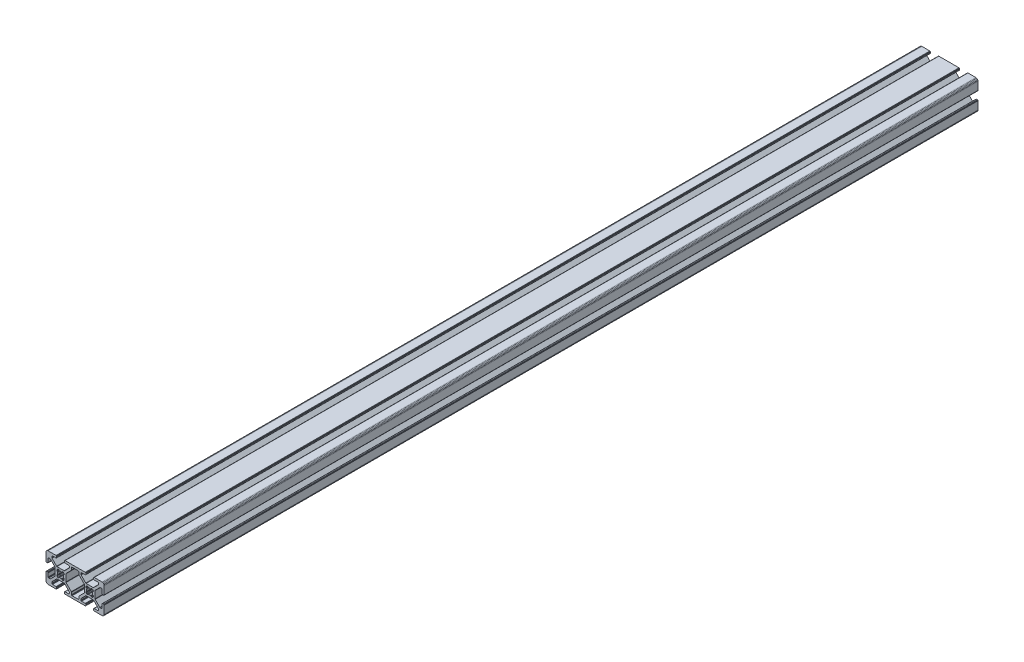
from build123d import *

# Parameters (mm, degrees)
BOSS_EXTRUDE1_DEPTH = 600


with BuildPart() as part:
    # Model → Boss-Extrude1 (new body)
    with BuildSketch(Plane.XY):
        Polygon((955.830371496, 646.201018815), (955.77077468, 646.171628917), (955.715523874, 646.134711509), (955.665564435, 646.090898257), (955.621751183, 646.040938818), (955.584833775, 645.985688012), (955.555443878, 645.926091196), (955.53408436, 645.863168087), (955.52112069, 645.797995318), (955.51677468, 645.731688012), (955.51677468, 645.005768674), (955.517862347, 644.972543884), (955.52112069, 644.939461368), (955.526535758, 644.90666279), (955.53408436, 644.874288599), (955.543734174, 644.842477425), (955.555443878, 644.81136549), (955.569163327, 644.781086019), (955.584833775, 644.751768674), (955.602388117, 644.723538995), (955.621751183, 644.696517868), (955.642840058, 644.670820999), (955.665564435, 644.646558429), (958.768645097, 641.543477767), (958.792907668, 641.52075339), (958.818604536, 641.499664515), (958.845625663, 641.480301449), (958.873855342, 641.462747107), (958.903172687, 641.447076659), (958.933452158, 641.43335721), (958.964564093, 641.421647506), (958.996375267, 641.411997692), (959.028749458, 641.40444909), (959.061548036, 641.399034023), (959.094630552, 641.395775679), (959.127855342, 641.394688012), (963.895694019, 641.394688012), (963.928918808, 641.395775679), (963.962001324, 641.399034023), (963.994799902, 641.40444909), (964.027174093, 641.411997692), (964.058985267, 641.421647506), (964.090097202, 641.43335721), (964.120376673, 641.447076659), (964.149694019, 641.462747107), (964.177923697, 641.480301449), (964.204944825, 641.499664515), (964.230641693, 641.52075339), (964.254904263, 641.543477767), (967.357984925, 644.646558429), (967.380709302, 644.670821), (967.401798177, 644.696517868), (967.421161243, 644.723538995), (967.438715585, 644.751768674), (967.454386033, 644.781086019), (967.468105483, 644.81136549), (967.479815186, 644.842477425), (967.489465, 644.874288599), (967.497013603, 644.90666279), (967.50242867, 644.939461368), (967.505687013, 644.972543884), (967.50677468, 645.005768674), (967.50677468, 645.731688012), (967.50242867, 645.797995318), (967.489465, 645.863168087), (967.468105483, 645.926091196), (967.438715585, 645.985688012), (967.401798177, 646.040938818), (967.357984925, 646.090898257), (967.308025486, 646.134711509), (967.25277468, 646.171628917), (967.193177864, 646.201018815), (967.130254755, 646.222378332), (967.065081986, 646.235342002), (966.99877468, 646.239688012), (964.64977468, 646.239688012), (964.583467374, 646.244034023), (964.518294605, 646.256997692), (964.455371496, 646.27835721), (964.39577468, 646.307747107), (964.340523874, 646.344664515), (964.290564435, 646.388477767), (964.246751183, 646.438437206), (964.209833775, 646.493688012), (964.180443878, 646.553284828), (964.15908436, 646.616207937), (964.146120691, 646.681380706), (964.14177468, 646.747688012), (964.14177468, 647.231688012), (964.146120691, 647.297995318), (964.15908436, 647.363168087), (964.180443878, 647.426091196), (964.209833775, 647.485688012), (964.246751183, 647.540938818), (964.290564435, 647.590898257), (964.340523874, 647.634711509), (964.39577468, 647.671628917), (964.455371496, 647.701018815), (964.518294605, 647.722378332), (964.583467374, 647.735342002), (964.64977468, 647.739688012), (978.37377468, 647.739688012), (978.440081986, 647.735342002), (978.505254755, 647.722378332), (978.568177864, 647.701018815), (978.62777468, 647.671628917), (978.683025486, 647.634711509), (978.732984925, 647.590898257), (978.776798177, 647.540938818), (978.813715585, 647.485688012), (978.843105483, 647.426091196), (978.864465, 647.363168087), (978.87742867, 647.297995318), (978.88177468, 647.231688012), (978.88177468, 646.747688012), (978.87742867, 646.681380706), (978.864465, 646.616207937), (978.843105483, 646.553284828), (978.813715585, 646.493688012), (978.776798177, 646.438437206), (978.732984925, 646.388477767), (978.683025486, 646.344664515), (978.62777468, 646.307747107), (978.568177864, 646.27835721), (978.505254755, 646.256997692), (978.440081986, 646.244034023), (978.37377468, 646.239688012), (976.02477468, 646.239688012), (975.958467374, 646.235342002), (975.893294605, 646.222378332), (975.830371496, 646.201018815), (975.77077468, 646.171628917), (975.715523874, 646.134711509), (975.665564435, 646.090898257), (975.621751183, 646.040938818), (975.584833775, 645.985688012), (975.555443878, 645.926091196), (975.53408436, 645.863168087), (975.521120691, 645.797995318), (975.51677468, 645.731688012), (975.51677468, 645.005768674), (975.517862347, 644.972543884), (975.521120691, 644.939461368), (975.526535758, 644.90666279), (975.53408436, 644.874288599), (975.543734174, 644.842477425), (975.555443878, 644.81136549), (975.569163327, 644.781086019), (975.584833775, 644.751768674), (975.602388117, 644.723538995), (975.621751183, 644.696517868), (975.642840058, 644.670821), (975.665564435, 644.646558429), (978.768645097, 641.543477767), (978.792907668, 641.52075339), (978.818604536, 641.499664515), (978.845625663, 641.480301449), (978.873855342, 641.462747107), (978.903172687, 641.447076659), (978.933452158, 641.43335721), (978.964564093, 641.421647506), (978.996375267, 641.411997692), (979.028749458, 641.40444909), (979.061548036, 641.399034023), (979.094630552, 641.395775679), (979.127855342, 641.394688012), (983.895694019, 641.394688012), (983.928918808, 641.395775679), (983.962001324, 641.399034023), (983.994799902, 641.40444909), (984.027174093, 641.411997692), (984.058985267, 641.421647506), (984.090097202, 641.43335721), (984.120376673, 641.447076659), (984.149694019, 641.462747107), (984.177923697, 641.480301449), (984.204944825, 641.499664515), (984.230641693, 641.52075339), (984.254904263, 641.543477767), (987.357984925, 644.646558429), (987.380709302, 644.670821), (987.401798177, 644.696517868), (987.421161243, 644.723538995), (987.438715585, 644.751768674), (987.454386033, 644.781086019), (987.468105483, 644.81136549), (987.479815186, 644.842477425), (987.489465, 644.874288599), (987.497013603, 644.90666279), (987.50242867, 644.939461368), (987.505687013, 644.972543884), (987.50677468, 645.005768674), (987.50677468, 645.731688012), (987.50242867, 645.797995318), (987.489465, 645.863168087), (987.468105483, 645.926091196), (987.438715585, 645.985688012), (987.401798177, 646.040938818), (987.357984925, 646.090898257), (987.308025486, 646.134711509), (987.25277468, 646.171628917), (987.193177864, 646.201018815), (987.130254755, 646.222378332), (987.065081986, 646.235342002), (986.99877468, 646.239688012), (984.64977468, 646.239688012), (984.583467374, 646.244034023), (984.518294605, 646.256997692), (984.455371496, 646.27835721), (984.39577468, 646.307747107), (984.340523874, 646.344664515), (984.290564435, 646.388477767), (984.246751183, 646.438437206), (984.209833775, 646.493688012), (984.180443878, 646.553284828), (984.15908436, 646.616207937), (984.14612069, 646.681380706), (984.14177468, 646.747688012), (984.14177468, 647.231688012), (984.14612069, 647.297995318), (984.15908436, 647.363168087), (984.180443878, 647.426091196), (984.209833775, 647.485688012), (984.246751183, 647.540938818), (984.290564435, 647.590898257), (984.340523874, 647.634711509), (984.39577468, 647.671628917), (984.455371496, 647.701018815), (984.518294605, 647.722378332), (984.583467374, 647.735342002), (984.64977468, 647.739688012), (990.01177468, 647.739688012), (990.207563968, 647.726855304), (990.400003248, 647.688576752), (990.585799829, 647.625507311), (990.76177468, 647.538726118), (990.924916824, 647.429718023), (991.072434852, 647.300348184), (991.201804691, 647.152830156), (991.310812786, 646.989688012), (991.397593979, 646.813713161), (991.46066342, 646.62791658), (991.498941972, 646.4354773), (991.51177468, 646.239688012), (991.51177468, 640.877688012), (991.50742867, 640.811380706), (991.494465, 640.746207937), (991.473105483, 640.683284828), (991.443715585, 640.623688012), (991.406798177, 640.568437206), (991.362984925, 640.518477767), (991.313025486, 640.474664515), (991.25777468, 640.437747107), (991.198177864, 640.40835721), (991.135254755, 640.386997692), (991.070081986, 640.374034023), (991.00377468, 640.369688012), (990.51977468, 640.369688012), (990.453467374, 640.374034023), (990.388294605, 640.386997692), (990.325371496, 640.40835721), (990.26577468, 640.437747107), (990.210523874, 640.474664515), (990.160564435, 640.518477767), (990.116751183, 640.568437206), (990.079833775, 640.623688012), (990.050443878, 640.683284828), (990.02908436, 640.746207937), (990.01612069, 640.811380706), (990.01177468, 640.877688012), (990.01177468, 643.226688012), (990.00742867, 643.292995318), (989.994465, 643.358168087), (989.973105483, 643.421091196), (989.943715585, 643.480688012), (989.906798177, 643.535938818), (989.862984925, 643.585898257), (989.813025486, 643.629711509), (989.75777468, 643.666628917), (989.698177864, 643.696018815), (989.635254755, 643.717378332), (989.570081986, 643.730342002), (989.50377468, 643.734688012), (988.777855342, 643.734688012), (988.744630552, 643.733600345), (988.711548036, 643.730342002), (988.678749458, 643.724926935), (988.646375267, 643.717378332), (988.614564093, 643.707728518), (988.583452158, 643.696018815), (988.553172687, 643.682299365), (988.523855342, 643.666628917), (988.495625663, 643.649074575), (988.468604536, 643.629711509), (988.442907667, 643.608622634), (988.418645097, 643.585898257), (985.315564435, 640.482817595), (985.292840058, 640.458555025), (985.271751183, 640.432858157), (985.252388117, 640.405837029), (985.234833775, 640.377607351), (985.219163327, 640.348290005), (985.205443878, 640.318010534), (985.193734174, 640.286898599), (985.18408436, 640.255087426), (985.176535758, 640.222713234), (985.17112069, 640.189914656), (985.167862347, 640.15683214), (985.16677468, 640.123607351), (985.16677468, 635.355768674), (985.167862347, 635.322543884), (985.17112069, 635.289461368), (985.176535758, 635.25666279), (985.18408436, 635.224288599), (985.193734174, 635.192477425), (985.205443878, 635.16136549), (985.219163327, 635.131086019), (985.234833775, 635.101768674), (985.252388117, 635.073538995), (985.271751183, 635.046517868), (985.292840058, 635.020821), (985.315564435, 634.996558429), (988.418645097, 631.893477767), (988.442907668, 631.87075339), (988.468604536, 631.849664515), (988.495625663, 631.830301449), (988.523855342, 631.812747107), (988.553172687, 631.797076659), (988.583452158, 631.78335721), (988.614564093, 631.771647506), (988.646375267, 631.761997692), (988.678749458, 631.75444909), (988.711548036, 631.749034023), (988.744630552, 631.745775679), (988.777855342, 631.744688012), (989.50377468, 631.744688012), (989.570081986, 631.749034023), (989.635254755, 631.761997692), (989.698177864, 631.78335721), (989.75777468, 631.812747107), (989.813025486, 631.849664515), (989.862984925, 631.893477767), (989.906798177, 631.943437206), (989.943715585, 631.998688012), (989.973105483, 632.058284828), (989.994465, 632.121207937), (990.00742867, 632.186380706), (990.01177468, 632.252688012), (990.01177468, 634.601688012), (990.016120691, 634.667995318), (990.02908436, 634.733168087), (990.050443878, 634.796091196), (990.079833775, 634.855688012), (990.116751183, 634.910938818), (990.160564435, 634.960898257), (990.210523874, 635.004711509), (990.26577468, 635.041628917), (990.325371496, 635.071018815), (990.388294605, 635.092378332), (990.453467374, 635.105342002), (990.51977468, 635.109688012), (991.00377468, 635.109688012), (991.070081986, 635.105342002), (991.135254755, 635.092378332), (991.198177864, 635.071018815), (991.25777468, 635.041628917), (991.313025486, 635.004711509), (991.362984925, 634.960898257), (991.406798177, 634.910938818), (991.443715585, 634.855688012), (991.473105483, 634.796091196), (991.494465, 634.733168087), (991.50742867, 634.667995318), (991.51177468, 634.601688012), (991.51177468, 629.239688012), (991.498941972, 629.043898724), (991.46066342, 628.851459444), (991.397593979, 628.665662864), (991.310812786, 628.489688012), (991.201804691, 628.326545869), (991.072434852, 628.17902784), (990.924916824, 628.049658002), (990.76177468, 627.940649906), (990.585799829, 627.853868713), (990.400003248, 627.790799273), (990.207563968, 627.75252072), (990.01177468, 627.739688012), (984.64977468, 627.739688012), (984.583467374, 627.744034023), (984.518294605, 627.756997692), (984.455371496, 627.77835721), (984.39577468, 627.807747107), (984.340523874, 627.844664515), (984.290564435, 627.888477767), (984.246751183, 627.938437206), (984.209833775, 627.993688012), (984.180443878, 628.053284828), (984.15908436, 628.116207937), (984.146120691, 628.181380706), (984.14177468, 628.247688012), (984.14177468, 628.731688012), (984.146120691, 628.797995318), (984.15908436, 628.863168087), (984.180443878, 628.926091196), (984.209833775, 628.985688012), (984.246751183, 629.040938818), (984.290564435, 629.090898257), (984.340523874, 629.134711509), (984.39577468, 629.171628917), (984.455371496, 629.201018815), (984.518294605, 629.222378332), (984.583467374, 629.235342002), (984.64977468, 629.239688012), (986.99877468, 629.239688012), (987.065081986, 629.244034023), (987.130254755, 629.256997692), (987.193177864, 629.27835721), (987.25277468, 629.307747107), (987.308025486, 629.344664515), (987.357984925, 629.388477767), (987.401798177, 629.438437206), (987.438715585, 629.493688012), (987.468105483, 629.553284828), (987.489465, 629.616207937), (987.50242867, 629.681380706), (987.50677468, 629.747688012), (987.50677468, 630.473607351), (987.505687013, 630.50683214), (987.50242867, 630.539914656), (987.497013603, 630.572713234), (987.489465, 630.605087426), (987.479815186, 630.636898599), (987.468105483, 630.668010534), (987.454386033, 630.698290005), (987.438715585, 630.727607351), (987.421161243, 630.755837029), (987.401798177, 630.782858157), (987.380709302, 630.808555025), (987.357984925, 630.832817595), (984.254904263, 633.935898257), (984.230641693, 633.958622634), (984.204944825, 633.979711509), (984.177923697, 633.999074575), (984.149694019, 634.016628917), (984.120376673, 634.032299365), (984.090097202, 634.046018815), (984.058985267, 634.057728518), (984.027174093, 634.067378332), (983.994799902, 634.074926935), (983.962001324, 634.080342002), (983.928918808, 634.083600345), (983.895694019, 634.084688012), (979.127855342, 634.084688012), (979.094630552, 634.083600345), (979.061548036, 634.080342002), (979.028749458, 634.074926935), (978.996375267, 634.067378332), (978.964564093, 634.057728518), (978.933452158, 634.046018815), (978.903172687, 634.032299365), (978.873855342, 634.016628917), (978.845625663, 633.999074575), (978.818604536, 633.979711509), (978.792907668, 633.958622634), (978.768645097, 633.935898257), (975.665564435, 630.832817595), (975.642840058, 630.808555025), (975.621751183, 630.782858157), (975.602388117, 630.755837029), (975.584833775, 630.727607351), (975.569163327, 630.698290005), (975.555443878, 630.668010534), (975.543734174, 630.636898599), (975.53408436, 630.605087425), (975.526535758, 630.572713234), (975.521120691, 630.539914656), (975.517862347, 630.50683214), (975.51677468, 630.473607351), (975.51677468, 629.747688012), (975.521120691, 629.681380706), (975.53408436, 629.616207937), (975.555443878, 629.553284828), (975.584833775, 629.493688012), (975.621751183, 629.438437206), (975.665564435, 629.388477767), (975.715523874, 629.344664515), (975.77077468, 629.307747107), (975.830371496, 629.27835721), (975.893294605, 629.256997692), (975.958467374, 629.244034023), (976.02477468, 629.239688012), (978.37377468, 629.239688012), (978.440081986, 629.235342002), (978.505254755, 629.222378332), (978.568177864, 629.201018815), (978.62777468, 629.171628917), (978.683025486, 629.134711509), (978.732984925, 629.090898257), (978.776798177, 629.040938818), (978.813715585, 628.985688012), (978.843105483, 628.926091196), (978.864465, 628.863168087), (978.87742867, 628.797995318), (978.88177468, 628.731688012), (978.88177468, 628.247688012), (978.87742867, 628.181380706), (978.864465, 628.116207937), (978.843105483, 628.053284828), (978.813715585, 627.993688012), (978.776798177, 627.938437206), (978.732984925, 627.888477767), (978.683025486, 627.844664515), (978.62777468, 627.807747107), (978.568177864, 627.77835721), (978.505254755, 627.756997692), (978.440081986, 627.744034023), (978.37377468, 627.739688012), (964.64977468, 627.739688012), (964.583467374, 627.744034023), (964.518294605, 627.756997692), (964.455371496, 627.77835721), (964.39577468, 627.807747107), (964.340523874, 627.844664515), (964.290564435, 627.888477767), (964.246751183, 627.938437206), (964.209833775, 627.993688012), (964.180443878, 628.053284828), (964.15908436, 628.116207937), (964.146120691, 628.181380706), (964.14177468, 628.247688012), (964.14177468, 628.731688012), (964.146120691, 628.797995318), (964.15908436, 628.863168087), (964.180443878, 628.926091196), (964.209833775, 628.985688012), (964.246751183, 629.040938818), (964.290564435, 629.090898257), (964.340523874, 629.134711509), (964.39577468, 629.171628917), (964.455371496, 629.201018815), (964.518294605, 629.222378332), (964.583467374, 629.235342002), (964.64977468, 629.239688012), (966.99877468, 629.239688012), (967.065081986, 629.244034023), (967.130254755, 629.256997692), (967.193177864, 629.27835721), (967.25277468, 629.307747107), (967.308025486, 629.344664515), (967.357984925, 629.388477767), (967.401798177, 629.438437206), (967.438715585, 629.493688012), (967.468105483, 629.553284828), (967.489465, 629.616207937), (967.50242867, 629.681380706), (967.50677468, 629.747688012), (967.50677468, 630.473607351), (967.505687013, 630.50683214), (967.50242867, 630.539914656), (967.497013603, 630.572713234), (967.489465, 630.605087425), (967.479815186, 630.636898599), (967.468105483, 630.668010534), (967.454386033, 630.698290005), (967.438715585, 630.727607351), (967.421161243, 630.755837029), (967.401798177, 630.782858157), (967.380709302, 630.808555025), (967.357984925, 630.832817595), (964.254904263, 633.935898257), (964.230641693, 633.958622634), (964.204944825, 633.979711509), (964.177923697, 633.999074575), (964.149694019, 634.016628917), (964.120376673, 634.032299365), (964.090097202, 634.046018815), (964.058985267, 634.057728518), (964.027174093, 634.067378332), (963.994799902, 634.074926935), (963.962001324, 634.080342002), (963.928918808, 634.083600345), (963.895694019, 634.084688012), (959.127855342, 634.084688012), (959.094630552, 634.083600345), (959.061548036, 634.080342002), (959.028749458, 634.074926935), (958.996375267, 634.067378332), (958.964564093, 634.057728518), (958.933452158, 634.046018815), (958.903172687, 634.032299365), (958.873855342, 634.016628917), (958.845625663, 633.999074575), (958.818604536, 633.979711509), (958.792907668, 633.958622634), (958.768645097, 633.935898257), (955.665564435, 630.832817595), (955.642840058, 630.808555025), (955.621751183, 630.782858157), (955.602388117, 630.755837029), (955.584833775, 630.727607351), (955.569163327, 630.698290005), (955.555443878, 630.668010534), (955.543734174, 630.636898599), (955.53408436, 630.605087425), (955.526535758, 630.572713234), (955.521120691, 630.539914656), (955.517862347, 630.50683214), (955.51677468, 630.473607351), (955.51677468, 629.747688012), (955.521120691, 629.681380706), (955.53408436, 629.616207937), (955.555443878, 629.553284828), (955.584833775, 629.493688012), (955.621751183, 629.438437206), (955.665564435, 629.388477767), (955.715523874, 629.344664515), (955.77077468, 629.307747107), (955.830371496, 629.27835721), (955.893294605, 629.256997692), (955.958467374, 629.244034023), (956.02477468, 629.239688012), (958.37377468, 629.239688012), (958.440081986, 629.235342002), (958.505254755, 629.222378332), (958.568177864, 629.201018815), (958.62777468, 629.171628917), (958.683025486, 629.134711509), (958.732984925, 629.090898257), (958.776798177, 629.040938818), (958.813715585, 628.985688012), (958.843105483, 628.926091196), (958.864465, 628.863168087), (958.87742867, 628.797995318), (958.88177468, 628.731688012), (958.88177468, 628.247688012), (958.87742867, 628.181380706), (958.864465, 628.116207937), (958.843105483, 628.053284828), (958.813715585, 627.993688012), (958.776798177, 627.938437206), (958.732984925, 627.888477767), (958.683025486, 627.844664515), (958.62777468, 627.807747107), (958.568177864, 627.77835721), (958.505254755, 627.756997692), (958.440081986, 627.744034023), (958.37377468, 627.739688012), (953.01177468, 627.739688012), (952.815985392, 627.75252072), (952.623546112, 627.790799273), (952.437749532, 627.853868713), (952.26177468, 627.940649906), (952.098632537, 628.049658002), (951.951114508, 628.17902784), (951.82174467, 628.326545869), (951.712736574, 628.489688012), (951.625955381, 628.665662864), (951.562885941, 628.851459444), (951.524607388, 629.043898724), (951.51177468, 629.239688012), (951.51177468, 634.601688012), (951.516120691, 634.667995318), (951.52908436, 634.733168087), (951.550443878, 634.796091196), (951.579833775, 634.855688012), (951.616751183, 634.910938818), (951.660564435, 634.960898257), (951.710523874, 635.004711509), (951.76577468, 635.041628917), (951.825371496, 635.071018815), (951.888294605, 635.092378332), (951.953467374, 635.105342002), (952.01977468, 635.109688012), (952.50377468, 635.109688012), (952.570081986, 635.105342002), (952.635254755, 635.092378332), (952.698177864, 635.071018815), (952.75777468, 635.041628917), (952.813025486, 635.004711509), (952.862984925, 634.960898257), (952.906798177, 634.910938818), (952.943715585, 634.855688012), (952.973105483, 634.796091196), (952.994465, 634.733168087), (953.00742867, 634.667995318), (953.01177468, 634.601688012), (953.01177468, 632.252688012), (953.016120691, 632.186380706), (953.02908436, 632.121207937), (953.050443878, 632.058284828), (953.079833775, 631.998688012), (953.116751183, 631.943437206), (953.160564435, 631.893477767), (953.210523874, 631.849664515), (953.26577468, 631.812747107), (953.325371496, 631.78335721), (953.388294605, 631.761997692), (953.453467374, 631.749034023), (953.51977468, 631.744688012), (954.245694019, 631.744688012), (954.278918808, 631.745775679), (954.312001324, 631.749034023), (954.344799902, 631.75444909), (954.377174093, 631.761997692), (954.408985267, 631.771647506), (954.440097202, 631.78335721), (954.470376673, 631.797076659), (954.499694019, 631.812747107), (954.527923697, 631.830301449), (954.554944825, 631.849664515), (954.580641693, 631.87075339), (954.604904263, 631.893477767), (957.707984925, 634.996558429), (957.730709302, 635.020821), (957.751798177, 635.046517868), (957.771161243, 635.073538995), (957.788715585, 635.101768674), (957.804386033, 635.131086019), (957.818105483, 635.16136549), (957.829815186, 635.192477425), (957.839465, 635.224288599), (957.847013603, 635.25666279), (957.85242867, 635.289461368), (957.855687013, 635.322543884), (957.85677468, 635.355768674), (957.85677468, 640.123607351), (957.855687013, 640.15683214), (957.85242867, 640.189914656), (957.847013603, 640.222713234), (957.839465, 640.255087425), (957.829815186, 640.286898599), (957.818105483, 640.318010534), (957.804386033, 640.348290005), (957.788715585, 640.377607351), (957.771161243, 640.405837029), (957.751798177, 640.432858157), (957.730709302, 640.458555025), (957.707984925, 640.482817595), (954.604904263, 643.585898257), (954.580641693, 643.608622634), (954.554944825, 643.629711509), (954.527923697, 643.649074575), (954.499694019, 643.666628917), (954.470376673, 643.682299365), (954.440097202, 643.696018815), (954.408985267, 643.707728518), (954.377174093, 643.717378332), (954.344799902, 643.724926935), (954.312001324, 643.730342002), (954.278918808, 643.733600345), (954.245694019, 643.734688012), (953.51977468, 643.734688012), (953.453467374, 643.730342002), (953.388294605, 643.717378332), (953.325371496, 643.696018815), (953.26577468, 643.666628917), (953.210523874, 643.629711509), (953.160564435, 643.585898257), (953.116751183, 643.535938818), (953.079833775, 643.480688012), (953.050443878, 643.421091196), (953.02908436, 643.358168087), (953.01612069, 643.292995318), (953.01177468, 643.226688012), (953.01177468, 640.877688012), (953.00742867, 640.811380706), (952.994465, 640.746207937), (952.973105483, 640.683284828), (952.943715585, 640.623688012), (952.906798177, 640.568437206), (952.862984925, 640.518477767), (952.813025486, 640.474664515), (952.75777468, 640.437747107), (952.698177864, 640.40835721), (952.635254755, 640.386997692), (952.570081986, 640.374034022), (952.50377468, 640.369688012), (952.01977468, 640.369688012), (951.953467374, 640.374034022), (951.888294605, 640.386997692), (951.825371496, 640.40835721), (951.76577468, 640.437747107), (951.710523874, 640.474664515), (951.660564435, 640.518477767), (951.616751183, 640.568437206), (951.579833775, 640.623688012), (951.550443878, 640.683284828), (951.52908436, 640.746207937), (951.51612069, 640.811380706), (951.51177468, 640.877688012), (951.51177468, 646.239688012), (951.524607388, 646.4354773), (951.562885941, 646.62791658), (951.625955381, 646.813713161), (951.712736574, 646.989688012), (951.82174467, 647.152830156), (951.951114508, 647.300348184), (952.098632537, 647.429718023), (952.26177468, 647.538726118), (952.437749532, 647.625507311), (952.623546112, 647.688576751), (952.815985392, 647.726855304), (953.01177468, 647.739688012), (958.37377468, 647.739688012), (958.440081986, 647.735342002), (958.505254755, 647.722378332), (958.568177864, 647.701018815), (958.62777468, 647.671628917), (958.683025486, 647.634711509), (958.732984925, 647.590898257), (958.776798177, 647.540938818), (958.813715585, 647.485688012), (958.843105483, 647.426091196), (958.864465, 647.363168087), (958.87742867, 647.297995318), (958.88177468, 647.231688012), (958.88177468, 646.747688012), (958.87742867, 646.681380706), (958.864465, 646.616207937), (958.843105483, 646.553284828), (958.813715585, 646.493688012), (958.776798177, 646.438437206), (958.732984925, 646.388477767), (958.683025486, 646.344664515), (958.62777468, 646.307747107), (958.568177864, 646.27835721), (958.505254755, 646.256997692), (958.440081986, 646.244034022), (958.37377468, 646.239688012), (956.02477468, 646.239688012), (955.958467374, 646.235342002), (955.893294605, 646.222378332), align=None)
        Polygon((961.101867381, 635.684670675), (961.237518732, 635.662212639), (961.374350872, 635.648699024), (961.51177468, 635.644188012), (961.649198488, 635.648699024), (961.786030628, 635.662212639), (961.921681979, 635.684670675), (962.055568504, 635.71597644), (962.187113763, 635.755995149), (962.315751398, 635.804554506), (962.360433376, 635.673351007), (962.427439659, 635.552020899), (962.514691929, 635.444327452), (962.6194839, 635.35361097), (962.738565261, 635.282685188), (962.868242491, 635.233749995), (963.004493419, 635.208323205), (963.143091979, 635.207193473), (963.279739289, 635.230395842), (963.410196988, 635.277210647), (963.530418696, 635.346185845), (963.636675524, 635.435182046), (963.816280646, 635.614787168), (963.905276847, 635.721043996), (963.974252045, 635.841265705), (964.02106685, 635.971723403), (964.044269219, 636.108370713), (964.043139488, 636.246969273), (964.017712697, 636.383220201), (963.968777504, 636.512897432), (963.897851722, 636.631978793), (963.80713524, 636.736770763), (963.699441793, 636.824023033), (963.578111685, 636.891029316), (963.446908186, 636.935711294), (963.495467543, 637.064348929), (963.535486252, 637.195894189), (963.566792017, 637.329780713), (963.589250053, 637.465432064), (963.602763668, 637.602264204), (963.60727468, 637.739688012), (963.602763668, 637.87711182), (963.589250053, 638.01394396), (963.566792017, 638.149595311), (963.535486252, 638.283481836), (963.495467543, 638.415027095), (963.446908186, 638.54366473), (963.578111685, 638.588346708), (963.699441793, 638.655352991), (963.80713524, 638.742605261), (963.897851722, 638.847397232), (963.968777504, 638.966478593), (964.017712697, 639.096155823), (964.043139488, 639.232406751), (964.044269219, 639.371005311), (964.02106685, 639.507652621), (963.974252045, 639.63811032), (963.905276847, 639.758332028), (963.816280646, 639.864588856), (963.636675524, 640.044193978), (963.530418696, 640.133190179), (963.410196988, 640.202165377), (963.279739289, 640.248980182), (963.143091979, 640.272182551), (963.004493419, 640.27105282), (962.868242491, 640.245626029), (962.738565261, 640.196690836), (962.6194839, 640.125765054), (962.514691929, 640.035048572), (962.427439659, 639.927355125), (962.360433376, 639.806025017), (962.315751398, 639.674821518), (962.187113763, 639.723380875), (962.055568504, 639.763399584), (961.921681979, 639.794705349), (961.786030628, 639.817163385), (961.649198488, 639.830677), (961.51177468, 639.835188012), (961.374350872, 639.830677), (961.237518732, 639.817163385), (961.101867381, 639.794705349), (960.967980857, 639.763399584), (960.836435597, 639.723380875), (960.707797962, 639.674821518), (960.663115984, 639.806025017), (960.596109701, 639.927355125), (960.508857431, 640.035048572), (960.404065461, 640.125765054), (960.2849841, 640.196690836), (960.155306869, 640.245626029), (960.019055941, 640.27105282), (959.880457381, 640.272182551), (959.743810071, 640.248980182), (959.613352373, 640.202165377), (959.493130664, 640.133190179), (959.386873836, 640.044193978), (959.207268714, 639.864588856), (959.118272513, 639.758332028), (959.049297315, 639.63811032), (959.00248251, 639.507652621), (958.979280141, 639.371005311), (958.980409873, 639.232406751), (959.005836663, 639.096155823), (959.054771856, 638.966478593), (959.125697638, 638.847397232), (959.21641412, 638.742605261), (959.324107567, 638.655352991), (959.445437675, 638.588346708), (959.576641174, 638.54366473), (959.528081817, 638.415027095), (959.488063108, 638.283481836), (959.456757343, 638.149595311), (959.434299307, 638.01394396), (959.420785692, 637.87711182), (959.41627468, 637.739688012), (959.420785692, 637.602264204), (959.434299307, 637.465432064), (959.456757343, 637.329780713), (959.488063108, 637.195894189), (959.528081817, 637.064348929), (959.576641174, 636.935711294), (959.445437675, 636.891029316), (959.324107567, 636.824023033), (959.21641412, 636.736770763), (959.125697638, 636.631978793), (959.054771856, 636.512897432), (959.005836663, 636.383220201), (958.980409873, 636.246969273), (958.979280141, 636.108370713), (959.00248251, 635.971723403), (959.049297315, 635.841265705), (959.118272513, 635.721043996), (959.207268714, 635.614787168), (959.386873836, 635.435182046), (959.493130664, 635.346185845), (959.613352373, 635.277210647), (959.743810071, 635.230395842), (959.880457381, 635.207193473), (960.019055941, 635.208323205), (960.155306869, 635.233749995), (960.2849841, 635.282685188), (960.404065461, 635.35361097), (960.508857431, 635.444327452), (960.596109701, 635.552020899), (960.663115984, 635.673351007), (960.707797962, 635.804554506), (960.836435597, 635.755995149), (960.967980857, 635.71597644), align=None, mode=Mode.SUBTRACT)
        Polygon((973.818025486, 646.134711509), (973.76277468, 646.171628917), (973.703177864, 646.201018815), (973.640254755, 646.222378332), (973.575081986, 646.235342002), (973.50877468, 646.239688012), (969.51477468, 646.239688012), (969.448467374, 646.235342002), (969.383294605, 646.222378332), (969.320371496, 646.201018815), (969.26077468, 646.171628917), (969.205523874, 646.134711509), (969.155564435, 646.090898257), (969.111751183, 646.040938818), (969.074833775, 645.985688012), (969.045443878, 645.926091196), (969.02408436, 645.863168087), (969.011120691, 645.797995318), (969.00677468, 645.731688012), (969.00677468, 644.38444833), (969.005687013, 644.35122354), (969.00242867, 644.318141024), (968.997013603, 644.285342446), (968.989465, 644.252968255), (968.979815186, 644.221157082), (968.968105483, 644.190045146), (968.954386033, 644.159765675), (968.938715585, 644.13044833), (968.921161243, 644.102218652), (968.901798177, 644.075197524), (968.880709302, 644.049500656), (968.857984925, 644.025238085), (965.315564435, 640.482817595), (965.292840058, 640.458555025), (965.271751183, 640.432858157), (965.252388117, 640.405837029), (965.234833775, 640.377607351), (965.219163327, 640.348290005), (965.205443878, 640.318010534), (965.193734174, 640.286898599), (965.18408436, 640.255087425), (965.176535758, 640.222713234), (965.171120691, 640.189914656), (965.167862347, 640.15683214), (965.16677468, 640.123607351), (965.16677468, 635.355768674), (965.167862347, 635.322543884), (965.171120691, 635.289461368), (965.176535758, 635.25666279), (965.18408436, 635.224288599), (965.193734174, 635.192477425), (965.205443878, 635.16136549), (965.219163327, 635.131086019), (965.234833775, 635.101768674), (965.252388117, 635.073538995), (965.271751183, 635.046517868), (965.292840058, 635.020821), (965.315564435, 634.996558429), (968.857984925, 631.454137939), (968.880709302, 631.429875368), (968.901798177, 631.4041785), (968.921161243, 631.377157373), (968.938715585, 631.348927694), (968.954386033, 631.319610349), (968.968105483, 631.289330878), (968.979815186, 631.258218943), (968.989465, 631.226407769), (968.997013603, 631.194033578), (969.00242867, 631.161235), (969.005687013, 631.128152484), (969.00677468, 631.094927694), (969.00677468, 629.747688012), (969.011120691, 629.681380706), (969.02408436, 629.616207937), (969.045443878, 629.553284828), (969.074833775, 629.493688012), (969.111751183, 629.438437206), (969.155564435, 629.388477767), (969.205523874, 629.344664515), (969.26077468, 629.307747107), (969.320371497, 629.27835721), (969.383294605, 629.256997692), (969.448467374, 629.244034023), (969.51477468, 629.239688012), (973.50877468, 629.239688012), (973.575081986, 629.244034023), (973.640254755, 629.256997692), (973.703177864, 629.27835721), (973.76277468, 629.307747107), (973.818025486, 629.344664515), (973.867984925, 629.388477767), (973.911798177, 629.438437206), (973.948715585, 629.493688012), (973.978105483, 629.553284828), (973.999465, 629.616207937), (974.01242867, 629.681380706), (974.01677468, 629.747688012), (974.01677468, 631.094927694), (974.017862347, 631.128152484), (974.021120691, 631.161235), (974.026535758, 631.194033578), (974.03408436, 631.226407769), (974.043734174, 631.258218943), (974.055443878, 631.289330878), (974.069163327, 631.319610349), (974.084833775, 631.348927694), (974.102388117, 631.377157373), (974.121751183, 631.4041785), (974.142840058, 631.429875368), (974.165564435, 631.454137939), (977.707984925, 634.996558429), (977.730709302, 635.020821), (977.751798177, 635.046517868), (977.771161243, 635.073538995), (977.788715585, 635.101768674), (977.804386033, 635.131086019), (977.818105483, 635.16136549), (977.829815186, 635.192477425), (977.839465, 635.224288599), (977.847013603, 635.25666279), (977.85242867, 635.289461368), (977.855687013, 635.322543884), (977.85677468, 635.355768674), (977.85677468, 640.123607351), (977.855687013, 640.15683214), (977.85242867, 640.189914656), (977.847013603, 640.222713234), (977.839465, 640.255087426), (977.829815186, 640.286898599), (977.818105483, 640.318010534), (977.804386033, 640.348290005), (977.788715585, 640.377607351), (977.771161243, 640.405837029), (977.751798177, 640.432858157), (977.730709302, 640.458555025), (977.707984925, 640.482817595), (974.165564435, 644.025238085), (974.142840058, 644.049500656), (974.121751183, 644.075197524), (974.102388117, 644.102218652), (974.084833775, 644.13044833), (974.069163327, 644.159765675), (974.055443878, 644.190045146), (974.043734174, 644.221157082), (974.03408436, 644.252968255), (974.026535758, 644.285342446), (974.021120691, 644.318141024), (974.017862347, 644.35122354), (974.01677468, 644.38444833), (974.01677468, 645.731688012), (974.01242867, 645.797995318), (973.999465, 645.863168087), (973.978105483, 645.926091196), (973.948715585, 645.985688012), (973.911798177, 646.040938818), (973.867984925, 646.090898257), align=None, mode=Mode.SUBTRACT)
        Polygon((979.456757343, 638.149595311), (979.434299307, 638.01394396), (979.420785692, 637.87711182), (979.41627468, 637.739688012), (979.420785692, 637.602264204), (979.434299307, 637.465432064), (979.456757343, 637.329780713), (979.488063108, 637.195894189), (979.528081817, 637.064348929), (979.576641174, 636.935711294), (979.445437675, 636.891029316), (979.324107567, 636.824023033), (979.21641412, 636.736770763), (979.125697638, 636.631978793), (979.054771856, 636.512897432), (979.005836663, 636.383220201), (978.980409873, 636.246969273), (978.979280141, 636.108370713), (979.00248251, 635.971723403), (979.049297315, 635.841265705), (979.118272513, 635.721043996), (979.207268714, 635.614787168), (979.386873836, 635.435182046), (979.493130664, 635.346185845), (979.613352373, 635.277210647), (979.743810071, 635.230395842), (979.880457381, 635.207193473), (980.019055941, 635.208323205), (980.155306869, 635.233749995), (980.2849841, 635.282685188), (980.404065461, 635.35361097), (980.508857431, 635.444327452), (980.596109701, 635.552020899), (980.663115984, 635.673351007), (980.707797962, 635.804554506), (980.836435597, 635.755995149), (980.967980857, 635.71597644), (981.101867381, 635.684670675), (981.237518732, 635.662212639), (981.374350872, 635.648699024), (981.51177468, 635.644188012), (981.649198488, 635.648699024), (981.786030628, 635.662212639), (981.921681979, 635.684670675), (982.055568504, 635.71597644), (982.187113763, 635.755995149), (982.315751398, 635.804554506), (982.360433376, 635.673351007), (982.427439659, 635.552020899), (982.514691929, 635.444327452), (982.6194839, 635.35361097), (982.738565261, 635.282685188), (982.868242491, 635.233749995), (983.004493419, 635.208323205), (983.143091979, 635.207193473), (983.279739289, 635.230395842), (983.410196988, 635.277210647), (983.530418696, 635.346185845), (983.636675524, 635.435182046), (983.816280646, 635.614787168), (983.905276847, 635.721043996), (983.974252045, 635.841265705), (984.02106685, 635.971723403), (984.044269219, 636.108370713), (984.043139488, 636.246969273), (984.017712697, 636.383220201), (983.968777504, 636.512897432), (983.897851722, 636.631978793), (983.80713524, 636.736770763), (983.699441793, 636.824023033), (983.578111685, 636.891029316), (983.446908186, 636.935711294), (983.495467543, 637.064348929), (983.535486252, 637.195894189), (983.566792017, 637.329780713), (983.589250053, 637.465432064), (983.602763668, 637.602264204), (983.60727468, 637.739688012), (983.602763668, 637.87711182), (983.589250053, 638.01394396), (983.566792017, 638.149595311), (983.535486252, 638.283481836), (983.495467543, 638.415027095), (983.446908186, 638.54366473), (983.578111685, 638.588346708), (983.699441793, 638.655352991), (983.80713524, 638.742605261), (983.897851722, 638.847397232), (983.968777504, 638.966478593), (984.017712697, 639.096155823), (984.043139488, 639.232406751), (984.044269219, 639.371005311), (984.02106685, 639.507652621), (983.974252045, 639.63811032), (983.905276847, 639.758332028), (983.816280646, 639.864588856), (983.636675524, 640.044193978), (983.530418696, 640.133190179), (983.410196988, 640.202165377), (983.279739289, 640.248980182), (983.143091979, 640.272182551), (983.004493419, 640.27105282), (982.868242491, 640.245626029), (982.738565261, 640.196690836), (982.6194839, 640.125765054), (982.514691929, 640.035048572), (982.427439659, 639.927355125), (982.360433376, 639.806025017), (982.315751398, 639.674821518), (982.187113763, 639.723380875), (982.055568504, 639.763399584), (981.921681979, 639.794705349), (981.786030628, 639.817163385), (981.649198488, 639.830677), (981.51177468, 639.835188012), (981.374350872, 639.830677), (981.237518732, 639.817163385), (981.101867381, 639.794705349), (980.967980857, 639.763399584), (980.836435597, 639.723380875), (980.707797962, 639.674821518), (980.663115984, 639.806025017), (980.596109701, 639.927355125), (980.508857431, 640.035048572), (980.404065461, 640.125765054), (980.2849841, 640.196690836), (980.155306869, 640.245626029), (980.019055941, 640.27105282), (979.880457381, 640.272182551), (979.743810071, 640.248980182), (979.613352373, 640.202165377), (979.493130664, 640.133190179), (979.386873836, 640.044193978), (979.207268714, 639.864588856), (979.118272513, 639.758332028), (979.049297315, 639.63811032), (979.00248251, 639.507652621), (978.979280141, 639.371005311), (978.980409873, 639.232406751), (979.005836663, 639.096155823), (979.054771856, 638.966478593), (979.125697638, 638.847397232), (979.21641412, 638.742605261), (979.324107567, 638.655352991), (979.445437675, 638.588346708), (979.576641174, 638.54366473), (979.528081817, 638.415027095), (979.488063108, 638.283481836), align=None, mode=Mode.SUBTRACT)
    extrude(amount=BOSS_EXTRUDE1_DEPTH)


solid = part.part
